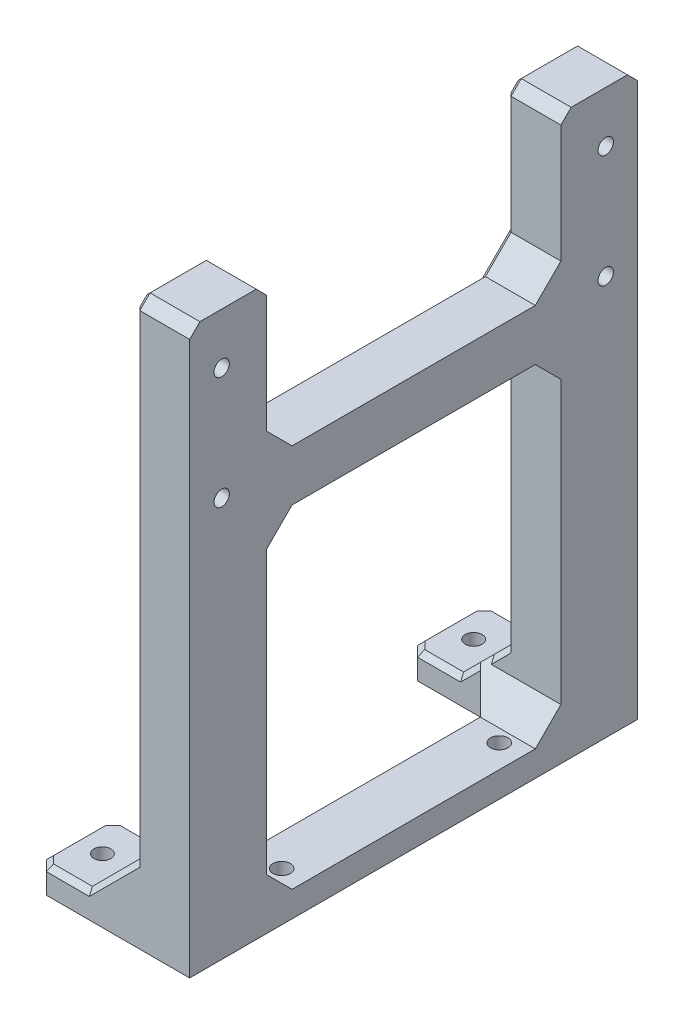
from build123d import *

# Parameters (mm, degrees)
EXTRUDE_1_DEPTH     = 15
SKETCH_3_W          = 10.742953118
SKETCH_3_H          = 10
EXTRUDE_2_DEPTH     = 57.5
SKETCH_4_W          = 10.742953118
SKETCH_4_H          = 5
EXTRUDE_3_DEPTH     = 57.5
CUT_EXTRUDE_1_REACH = 133.077
SKETCH_5_R          = 1.65
CUT_EXTRUDE_2_REACH = 137.116
SKETCH_6_R          = 1.7
CUT_EXTRUDE_3_REACH = 135.143
SKETCH_7_R          = 1.5
CHAMFER_1_SIZE      = 5
CHAMFER_2_SIZE      = 2
CHAMFER_3_SIZE      = 5
CHAMFER_4_SIZE      = 1


with BuildPart() as part:
    # 草图1 → 凸台-拉伸1 (new body)
    with BuildSketch(Plane.XY):
        Polygon((0, 110), (0, 0), (-30, 0), (-30, 5), (-20, 5), (-10.742953118, 14.257046882), (-10.742953118, 110), align=None)
    extrude(amount=EXTRUDE_1_DEPTH)


with BuildPart() as body_2:
    # 镜向9: mirrored copy
    add(part.part.mirror(Plane.XY.offset(-28.75)))


with BuildPart() as part_1:
    add(part.part)

    add(body_2.part)  # 凸台-拉伸2 merges body 2
    # 草图3 → 凸台-拉伸2 (add)
    with BuildSketch(Plane.XY.offset(-57.5)):
        with Locations((-5.371476559, 75)):
            Rectangle(SKETCH_3_W, SKETCH_3_H)
    extrude(amount=EXTRUDE_2_DEPTH)

    # 草图4 → 凸台-拉伸3 (add)
    with BuildSketch(Plane.XY.offset(-57.5)):
        with Locations((-5.371476559, 2.5)):
            Rectangle(SKETCH_4_W, SKETCH_4_H)
    extrude(amount=EXTRUDE_3_DEPTH)

    # 草图5 → 切除-拉伸1 (cut, up to next)
    with BuildSketch(Plane(origin=(0, 5, 0), x_dir=(1, 0, 0), z_dir=(0, 1, 0)), mode=Mode.PRIVATE) as cut_extrude_1_sk1:
        with Locations(Location((-24.537178605, 65, 0), (0, 0, 270))):
            Circle(SKETCH_5_R)
    cut_extrude_1_tool1 = extrude(cut_extrude_1_sk1.sketch, amount=-CUT_EXTRUDE_1_REACH, mode=Mode.PRIVATE) & part_1.part
    # 草图5 → 切除-拉伸1 (cut, up to next)
    with BuildSketch(Plane(origin=(0, 5, 0), x_dir=(1, 0, 0), z_dir=(0, 1, 0)), mode=Mode.PRIVATE) as cut_extrude_1_sk2:
        with Locations(Location((-24.537178605, -7.5, 0), (0, 0, 270))):
            Circle(SKETCH_5_R)
    cut_extrude_1_tool2 = extrude(cut_extrude_1_sk2.sketch, amount=-CUT_EXTRUDE_1_REACH, mode=Mode.PRIVATE) & part_1.part
    add(cut_extrude_1_tool1.solids().sort_by_distance((-24.537179, 5, -65))[0], mode=Mode.SUBTRACT)
    add(cut_extrude_1_tool2.solids().sort_by_distance((-24.537179, 5, 7.5))[0], mode=Mode.SUBTRACT)

    # 草图6 → 切除-拉伸2 (cut, up to next)
    with BuildSketch(Plane.XZ, mode=Mode.PRIVATE) as cut_extrude_2_sk1:
        with Locations((-4.537178605, -7.5)):
            Circle(SKETCH_6_R)
    cut_extrude_2_tool1 = extrude(cut_extrude_2_sk1.sketch, amount=-CUT_EXTRUDE_2_REACH, mode=Mode.PRIVATE) & part_1.part
    # 草图6 → 切除-拉伸2 (cut, up to next)
    with BuildSketch(Plane.XZ, mode=Mode.PRIVATE) as cut_extrude_2_sk2:
        with Locations((-4.537178605, -50)):
            Circle(SKETCH_6_R)
    cut_extrude_2_tool2 = extrude(cut_extrude_2_sk2.sketch, amount=-CUT_EXTRUDE_2_REACH, mode=Mode.PRIVATE) & part_1.part
    add(cut_extrude_2_tool1.solids().sort_by_distance((-4.537179, 0, -7.5))[0], mode=Mode.SUBTRACT)
    add(cut_extrude_2_tool2.solids().sort_by_distance((-4.537179, 0, -50))[0], mode=Mode.SUBTRACT)

    # 草图7 → 切除-拉伸3 (cut, up to next)
    with BuildSketch(Plane.ZY.offset(10.742953118), mode=Mode.PRIVATE) as cut_extrude_3_sk1:
        with Locations((-66.25, 100.05)):
            Circle(SKETCH_7_R)
    cut_extrude_3_tool1 = extrude(cut_extrude_3_sk1.sketch, amount=-CUT_EXTRUDE_3_REACH, mode=Mode.PRIVATE) & part_1.part
    # 草图7 → 切除-拉伸3 (cut, up to next)
    with BuildSketch(Plane.ZY.offset(10.742953118), mode=Mode.PRIVATE) as cut_extrude_3_sk2:
        with Locations((8.75, 100.05)):
            Circle(SKETCH_7_R)
    cut_extrude_3_tool2 = extrude(cut_extrude_3_sk2.sketch, amount=-CUT_EXTRUDE_3_REACH, mode=Mode.PRIVATE) & part_1.part
    # 草图7 → 切除-拉伸3 (cut, up to next)
    with BuildSketch(Plane.ZY.offset(10.742953118), mode=Mode.PRIVATE) as cut_extrude_3_sk3:
        with Locations((-66.25, 78.05)):
            Circle(SKETCH_7_R)
    cut_extrude_3_tool3 = extrude(cut_extrude_3_sk3.sketch, amount=-CUT_EXTRUDE_3_REACH, mode=Mode.PRIVATE) & part_1.part
    # 草图7 → 切除-拉伸3 (cut, up to next)
    with BuildSketch(Plane.ZY.offset(10.742953118), mode=Mode.PRIVATE) as cut_extrude_3_sk4:
        with Locations(Location((8.75, 78.05, 0), (0, 0, 270))):
            Circle(SKETCH_7_R)
    cut_extrude_3_tool4 = extrude(cut_extrude_3_sk4.sketch, amount=-CUT_EXTRUDE_3_REACH, mode=Mode.PRIVATE) & part_1.part
    add(cut_extrude_3_tool1.solids().sort_by_distance((-10.742953, 100.05, -66.25))[0], mode=Mode.SUBTRACT)
    add(cut_extrude_3_tool2.solids().sort_by_distance((-10.742953, 100.05, 8.75))[0], mode=Mode.SUBTRACT)
    add(cut_extrude_3_tool3.solids().sort_by_distance((-10.742953, 78.05, -66.25))[0], mode=Mode.SUBTRACT)
    add(cut_extrude_3_tool4.solids().sort_by_distance((-10.742953, 78.05, 8.75))[0], mode=Mode.SUBTRACT)

    # 倒角1
    chamfer_1_edges = [part_1.edges().sort_by_distance(p)[0] for p in [
        (-5.371476559, 80, 0),
        (-5.371476559, 80, -57.5),
        (-5.371476559, 70, 0),
        (-5.371476559, 70, -57.5),
        (-5.371476559, 5, 0),
        (-5.371476559, 5, -57.5),
    ]]
    chamfer(chamfer_1_edges, length=CHAMFER_1_SIZE)

    # 倒角2
    chamfer_2_edges = [part_1.edges().sort_by_distance(p)[0] for p in [
        (-5.371476559, 110, 0),
        (-30, 2.5, 15),
        (-5.371476559, 110, -57.5),
        (-30, 2.5, -57.5),
        (-5.371476559, 110, -72.5),
        (-30, 2.5, -72.5),
        (-5.371476559, 110, 15),
        (-30, 2.5, 0),
    ]]
    chamfer(chamfer_2_edges, length=CHAMFER_2_SIZE)

    # 倒角3
    # the kernel refuses this chamfer: 5 mm, written as the material it adds along each edge
    with BuildSketch(Plane(origin=(-10.742953118, 22.85841494, 0), x_dir=(-0.9996219169112968, 0, 0.027495876610586372), z_dir=(0, -1, 0))) as chamfer_3_piece_1_section:
        Polygon((CHAMFER_3_SIZE * 0.999621916911, CHAMFER_3_SIZE * 0.0274958766106), (-CHAMFER_3_SIZE * 0.0274958766106, CHAMFER_3_SIZE * 0.999621916911), (0, 0), align=None)
    chamfer_3_piece_1 = extrude(amount=22.85841494, mode=Mode.PRIVATE)
    chamfer_3_piece_1 = split(chamfer_3_piece_1, bisect_by=Plane(origin=(-12.636913345, 5, -1.178868923), z_dir=(0, 1, 0)), keep=Keep.TOP, mode=Mode.PRIVATE)
    chamfer_3_piece_1 = split(chamfer_3_piece_1, bisect_by=Plane(origin=(-12.636913345, 7.862667434, -2.137332566), z_dir=(0, -0.7071067811865476, 0.7071067811865476)), keep=Keep.TOP, mode=Mode.PRIVATE)
    chamfer_3_piece_1 = split(chamfer_3_piece_1, bisect_by=Plane(origin=(-15.366354777, 9.633645223, -1.178868923), z_dir=(0.7071067811865488, -0.7071067811865464, 0)), keep=Keep.TOP, mode=Mode.PRIVATE)
    add(chamfer_3_piece_1)
    with BuildSketch(Plane(origin=(-10.742953118, 22.85841494, 0), x_dir=(-0.9996219169112968, 0, 0.027495876610586372), z_dir=(0, -1, 0))) as chamfer_3_piece_2_section:
        Polygon((CHAMFER_3_SIZE * 0.999621916911, CHAMFER_3_SIZE * 0.0274958766106), (-CHAMFER_3_SIZE * 0.0274958766106, CHAMFER_3_SIZE * 0.999621916911), (0, 0), align=None)
    chamfer_3_piece_2 = extrude(amount=22.85841494, mode=Mode.PRIVATE)
    chamfer_3_piece_2 = split(chamfer_3_piece_2, bisect_by=Plane(origin=(-12.391958981, 5, -1.648896507), z_dir=(0, -1, 0)), keep=Keep.TOP, mode=Mode.PRIVATE)
    chamfer_3_piece_2 = split(chamfer_3_piece_2, bisect_by=Plane(origin=(-12.391958981, 5.425526159, -4.574473841), z_dir=(0, -0.7071067811865476, 0.7071067811865476)), keep=Keep.TOP, mode=Mode.PRIVATE)
    add(chamfer_3_piece_2)
    with BuildSketch(Plane(origin=(-10.742953118, 0, -57.5), x_dir=(-0.9996219169112968, 0, -0.027495876610586317), z_dir=(0, 1, 0))) as chamfer_3_piece_3_section:
        Polygon((CHAMFER_3_SIZE * 0.999621916911, CHAMFER_3_SIZE * 0.0274958766106), (-CHAMFER_3_SIZE * 0.0274958766106, CHAMFER_3_SIZE * 0.999621916911), (0, 0), align=None)
    chamfer_3_piece_3 = extrude(amount=22.85841494, mode=Mode.PRIVATE)
    chamfer_3_piece_3 = split(chamfer_3_piece_3, bisect_by=Plane(origin=(-12.391958981, 5.425526159, -52.925526159), z_dir=(0, -0.7071067811865476, -0.7071067811865476)), keep=Keep.TOP, mode=Mode.PRIVATE)
    chamfer_3_piece_3 = split(chamfer_3_piece_3, bisect_by=Plane(origin=(-12.391958981, 5, -55.851103493), z_dir=(0, -1, 0)), keep=Keep.TOP, mode=Mode.PRIVATE)
    add(chamfer_3_piece_3)
    with BuildSketch(Plane(origin=(-10.742953118, 0, -57.5), x_dir=(-0.9996219169112968, 0, -0.027495876610586317), z_dir=(0, 1, 0))) as chamfer_3_piece_4_section:
        Polygon((CHAMFER_3_SIZE * 0.999621916911, CHAMFER_3_SIZE * 0.0274958766106), (-CHAMFER_3_SIZE * 0.0274958766106, CHAMFER_3_SIZE * 0.999621916911), (0, 0), align=None)
    chamfer_3_piece_4 = extrude(amount=22.85841494, mode=Mode.PRIVATE)
    chamfer_3_piece_4 = split(chamfer_3_piece_4, bisect_by=Plane(origin=(-12.636913345, 7.862667434, -55.362667434), z_dir=(0, -0.7071067811865476, -0.7071067811865476)), keep=Keep.TOP, mode=Mode.PRIVATE)
    chamfer_3_piece_4 = split(chamfer_3_piece_4, bisect_by=Plane(origin=(-15.366354777, 9.633645223, -56.321131077), z_dir=(0.7071067811865488, -0.7071067811865464, 0)), keep=Keep.TOP, mode=Mode.PRIVATE)
    chamfer_3_piece_4 = split(chamfer_3_piece_4, bisect_by=Plane(origin=(-12.636913345, 5, -56.321131077), z_dir=(0, 1, 0)), keep=Keep.TOP, mode=Mode.PRIVATE)
    add(chamfer_3_piece_4)

    # 倒角4
    chamfer_4_edges = [part_1.edges().sort_by_distance(p)[0] for p in [
        (-10.742953118, 39.628523441, 0),
        (-10.742953118, 39.628523441, -57.5),
        (-10.742953118, 70, -28.75),
        (-10.742953118, 80, -28.75),
        (-10.742953118, 67.5, -55),
        (-10.742953118, 67.5, -2.5),
        (-10.742953118, 82.5, -2.5),
        (-10.742953118, 82.5, -55),
        (-15.371476559, 9.628523441, 15),
        (-10.742953118, 61.128523441, 15),
        (-24, 5, 15),
        (-30, 5, 7.5),
        (-29, 5, 1),
        (-29, 5, 14),
        (-30, 5, -65),
        (-29, 5, -71.5),
        (-29, 5, -58.5),
        (-10.742953118, 61.128523441, -72.5),
        (-10.742953118, 96.5, 0),
        (-10.742953118, 96.5, -57.5),
        (-10.742953118, 110, -65),
        (-10.742953118, 110, 7.5),
        (-10.742953118, 109, -71.5),
        (-10.742953118, 109, -58.5),
        (-10.742953118, 109, 1),
        (-10.742953118, 109, 14),
        (-17.871476559, 7.128523441, 0),
        (-17.871476559, 7.128523441, -57.5),
        (-12.871476559, 12.128523441, -57.5),
        (-24, 5, -57.5),
        (-15.371476559, 9.628523441, -72.5),
        (-24, 5, -72.5),
        (-24, 5, 0),
        (-12.871476559, 12.128523441, 0),
    ]]
    chamfer(chamfer_4_edges, length=CHAMFER_4_SIZE)


solid = part_1.part
